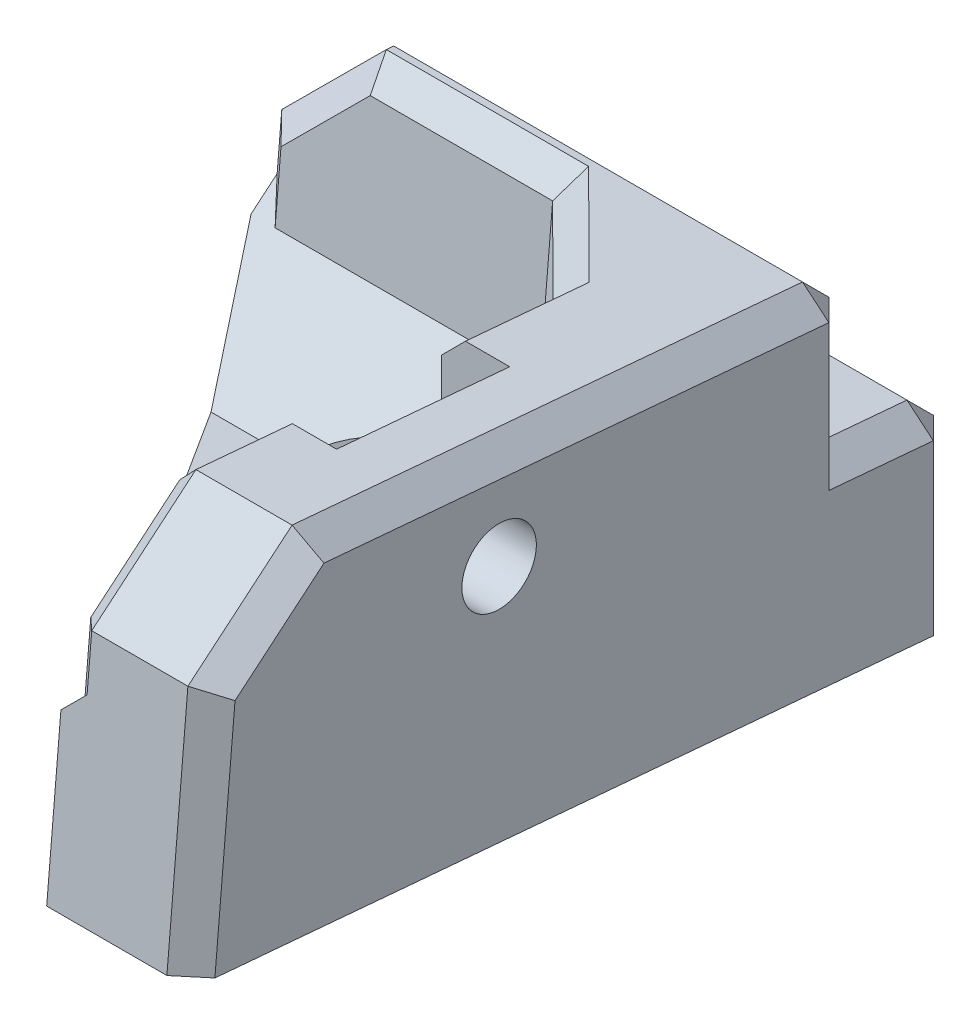
from build123d import *
from OCP.BRepFilletAPI import BRepFilletAPI_MakeChamfer

# Parameters (mm, degrees)
BOSS_EXTRUDE3_DEPTH             = 12.7
CUT_EXTRUDE1_DEPTH              = 2446.156245266122
CUT_EXTRUDE2_DEPTH              = 25.4
BOSS_EXTRUDE4_DEPTH             = 9.525
BOSS_EXTRUDE5_START             = -133.985000001
BOSS_EXTRUDE5_DEPTH             = 34.925
CUT_EXTRUDE3_REACH              = 2445.46
SKETCH12_W                      = 34.925000000000026
SKETCH12_H                      = 0.3325309889783057
CHAMFER4_SIZE                   = 6.35
CHAMFER5_SIZE                   = 1.5875
CHAMFER5_SIZE2                  = 1.7463498023569755
CHAMFER5_SIZE2_2                = 1.7463498023569135
CHAMFER5_SIZE2_3                = 1.695194438361193
CUT_EXTRUDE5_START              = 10.8585
CUT_EXTRUDE5_DEPTH              = 10.8585
F_8_START                       = -200.342016287
F_8_CLEARANCE_HOLE1_2_OUTLINE_W = 7
F_8_CLEARANCE_HOLE1_2_OUTLINE_H = 7
F_8_CLEARANCE_HOLE1_2_DEPTH     = 0.279842574
F_8_CLEARANCE_HOLE2_D           = 4.9149
CUT_EXTRUDE6_REACH              = 253.711
SKETCH24_R                      = 7.937499999999993


with BuildPart() as part:
    # Sketch6 → Boss-Extrude3 (new body)
    with BuildSketch(Plane(origin=(2.311843e-11, -2425.8151689885194, 212.23132709558422), x_dir=(1, 9.46e-15, -8.3e-16), z_dir=(9.493905125025943e-15, -0.9961946980917503, 0.08715574274760324))):
        Polygon((-99.0600000006817, -213.04201628669756), (-133.9850000006817, -213.04201628669756), (-133.9850000006817, -200.34201628669757), (-108.5850000006817, -162.24201628669755), (-99.0600000006817, -162.24201628669755), align=None)
    extrude(amount=-BOSS_EXTRUDE3_DEPTH)

    # Sketch7 → Cut-Extrude1 (cut, through all)
    with BuildSketch(Plane.ZY.offset(133.9850000006817)):
        Polygon((-2.4964e-13, -2444.383004154433), (0, -2431.6344922176327), (-1.1068779328950917, -2431.7313314886683), align=None)
    extrude(amount=-CUT_EXTRUDE1_DEPTH, mode=Mode.SUBTRACT)

    # Sketch8 → Cut-Extrude2 (cut)
    with BuildSketch(Plane.ZY.offset(133.9850000006817)):
        Polygon((50.219283386547545, -2435.5274069898373), (12.26426538925185, -2438.848040788521), (11.544794732870468, -2430.6244535557735), (49.49981273016616, -2427.30381975709), align=None)
    extrude(amount=-CUT_EXTRUDE2_DEPTH, mode=Mode.SUBTRACT)

    # Sketch10 → Boss-Extrude4 (add, through all)
    with BuildSketch(Plane.ZY.offset(108.58500000067501)):
        Polygon((49.499812730166134, -2427.3038197570895), (11.544794732870441, -2430.624453555773), (10.711465212786628, -2421.099453555773), (48.66648321008233, -2417.7788197570894), align=None)
    extrude(amount=-BOSS_EXTRUDE4_DEPTH)

    # Boss-Extrude5: read off the stored shape, not the designer's step
    # Boss-Extrude5 outline → Boss-Extrude5 (add)
    with BuildSketch(Plane.YZ.offset(BOSS_EXTRUDE5_START)):
        Polygon((-2420.768187948, 10.682483227), (-2430.624453556, 11.544794733), (-2431.031161645, 6.8961), (-2421.099453556, 6.8961), align=None)
    extrude(amount=BOSS_EXTRUDE5_DEPTH)

    # Sketch12 → Cut-Extrude3 (cut, up to next)
    with BuildSketch(Plane(origin=(0, -17.46095723301537, -199.5796544297948), x_dir=(1, 0, 0), z_dir=(0, 0.0871557427475931, 0.9961946980917512)), mode=Mode.PRIVATE) as cut_extrude3_sk1:
        with Locations((-116.52250000065857, -2412.653739397144)):
            Rectangle(SKETCH12_W, SKETCH12_H)
    cut_extrude3_tool1 = extrude(cut_extrude3_sk1.sketch, amount=-CUT_EXTRUDE3_REACH, mode=Mode.PRIVATE) & part.part
    add(cut_extrude3_tool1.solids().sort_by_distance((-116.5225, -2420.933821, 10.696974))[0], mode=Mode.SUBTRACT)

    # Chamfer4
    chamfer4_edges = [part.edges().sort_by_distance(p)[0] for p in [
        (-108.58500000065862, -2437.1877238891802, 31.241774387899785),
        (-108.58500000065875, -2425.8619535557737, 11.1281299728286),
        (-121.28500000065863, -2438.848040788522, 12.26426538925195),
        (-103.82250000065878, -2417.7788197570903, 48.6664832100824),
        (-133.98500000065857, -2421.266354157439, 8.803782606393371),
    ]]
    chamfer(chamfer4_edges, length=CHAMFER4_SIZE)

    # Chamfer5: one chamfer whose edges measure the first distance from different faces: ONE call of the kernel's chamfer builder (chamfer() names one face for all edges)
    chamfer5_edges_1 = [part.edges().sort_by_distance(p)[0] for p in [
        (-111.76000000038354, -2420.822734072567, 13.874383379035507),
        (-99.0600000006587, -2431.3328269313633, 3.4480500000041445),
        (-99.06000000065865, -2438.0087481860337, -4.5e-14),
        (-133.98500000065866, -2438.008748186034, -1.396e-14),
        (-133.98500000065872, -2431.332826931364, 3.448050000004116),
        (-133.985000001, -2429.419336186252, 6.8961),
        (-99.060000001, -2426.232208202052, 6.8961),
        (-108.58500000065878, -2419.43913665644, 29.688974211344913),
        (-99.06000000075693, -2419.8827567413205, 24.618373438599672),
        (-121.28500000051437, -2421.099453555774, 10.711465212786711),
        (-133.985000001, -2429.024871722332, 11.404849456074741),
        (-130.81000000070145, -2424.262371722282, 10.988184695738429),
        (-99.06000000065865, -2432.030074256415, 49.91330641979526),
        (-108.5850000006587, -2426.6531133734643, 49.44288329831503),
        (-108.58500000065877, -2421.218457406756, 45.780284526864456),
        (-99.06000000065876, -2421.2184574067555, 45.78028452686439),
    ]]
    chamfer5_edges_2 = [part.edges().sort_by_distance(p)[0] for p in [
        (-116.52250000065871, -2431.634492217634, 9.642e-14),
    ]]
    chamfer5_side_2 = [part.faces().sort_by_distance(p)[0] for p in [
        (-116.52250000065865, -2438.008748186034, -2.841e-14),
    ]]
    chamfer5_edges_3 = [part.edges().sort_by_distance(p)[0] for p in [
        (-113.34750000082943, -2421.433254759104, 6.896099999999999),
    ]]
    chamfer5_side_3 = [part.faces().sort_by_distance(p)[0] for p in [
        (-115.53645576803177, -2426.404038617734, 6.8961),
    ]]
    chamfer5_edges_4 = [part.edges().sort_by_distance(p)[0] for p in [
        (-130.81000000070134, -2424.6203827433465, 6.8961),
    ]]
    chamfer5_side_4 = [part.faces().sort_by_distance(p)[0] for p in [
        (-130.8815677895093, -2424.512945541763, 8.945261119766531),
    ]]
    chamfer5 = BRepFilletAPI_MakeChamfer(part.part.solid().wrapped)
    for e in chamfer5_edges_1:
        chamfer5.Add(CHAMFER5_SIZE, e.wrapped)
    for e in chamfer5_edges_2:
        chamfer5.Add(CHAMFER5_SIZE, CHAMFER5_SIZE2, e.wrapped, chamfer5_side_2[0].wrapped)  # the first distance lies on this face
    for e in chamfer5_edges_3:
        chamfer5.Add(CHAMFER5_SIZE, CHAMFER5_SIZE2_2, e.wrapped, chamfer5_side_3[0].wrapped)  # the first distance lies on this face
    for e in chamfer5_edges_4:
        chamfer5.Add(CHAMFER5_SIZE, CHAMFER5_SIZE2_3, e.wrapped, chamfer5_side_4[0].wrapped)  # the first distance lies on this face
    add(Compound.cast(chamfer5.Shape()), mode=Mode.REPLACE)

    # Sketch14 → CBORE for #8 Pan Head Machine Screw1 (revolve, cut)
    with BuildSketch(Plane(origin=(-108.58500000065874, -2425.9412416479745, 30.25783468724938), x_dir=(5.9e-16, 0, 1), z_dir=(-6.7e-15, 1, 0))):
        Polygon((0, 0), (-2.33e-15, 9.525000000000226), (2.4574499999999975, 9.525000000000226), (2.4574499999999997, 4.508499999999999), (5.715, 4.508499999999999), (5.715, 0), align=None)
    revolve(axis=Axis((-114.93500000065873, -2425.9412416479745, 30.257834687249385), (1, 7.96e-15, -5.9e-16)), mode=Mode.SUBTRACT)

    # Sketch16 → Cut-Extrude5 (cut)
    with BuildSketch(Plane.ZY.offset(104.07650000065875).offset(CUT_EXTRUDE5_START)):
        with BuildLine():
            Line((35.972834687249275, -2425.9412416479745), (35.972834687249254, -2417.8454644621274))
            Line((35.972834687249254, -2417.8454644621274), (24.542834687249364, -2418.845459886228))
            Line((24.542834687249364, -2418.845459886228), (24.542834687249364, -2425.9412416479745))
            ThreePointArc((24.542834687249364, -2425.9412416479745), (30.257834687249318, -2431.6562416479746), (35.972834687249275, -2425.9412416479745))
        make_face()
    extrude(amount=-CUT_EXTRUDE5_DEPTH, mode=Mode.SUBTRACT)

    # Sketch18 → Hole1 (revolve, cut)
    with BuildSketch(Plane(origin=(-121.28500000067221, -2436.8657251652107, -4.765035e-11), x_dir=(0, 1, 1.96e-14), z_dir=(1, 0, -8.3e-16))):
        Polygon((0, 0), (0, 4.6989999999999945), (2.870200000000013, 4.6989999999999945), (2.9972000000000123, 0), align=None)
    revolve(axis=Axis((-121.28500000067213, -2436.865725165213, 109.99999999995235), (-8.3e-16, 1.895e-14, -1)), mode=Mode.SUBTRACT)

    # #8 Clearance Hole1: read off the stored shape, not the designer's step
    # #8 Clearance Hole1 outline → #8 Clearance Hole1 (revolve, cut)
    with BuildSketch(Plane(origin=(-121.285000001, -2436.865725165, 0), x_dir=(1, 0, 0), z_dir=(0, -1, 0))):
        Polygon((2.45745, 4.699), (2.45745, 11.711826423), (1.590785336, 12.232571089), (0, 12.232571089), (0, 4.699), align=None)
    revolve(axis=Axis((-121.285000001, -2436.865725165, 0), (0, 0, 1)), mode=Mode.SUBTRACT)

    # 8 Clearance Hole1 2 outline → 8 Clearance Hole1 2 (add)
    with BuildSketch(Plane(origin=(0, 0, 0), x_dir=(1, 0, 0), z_dir=(0, 0.08715574274759312, 0.9961946980917512)).offset(F_8_START)):
        with Locations((-121.50000000000001, -2428.5)):
            Rectangle(F_8_CLEARANCE_HOLE1_2_OUTLINE_W, F_8_CLEARANCE_HOLE1_2_OUTLINE_H)
    extrude(amount=F_8_CLEARANCE_HOLE1_2_DEPTH)

    # #8 Clearance Hole2 (through all)
    with Locations(Plane(origin=(3.101414e-11, -2425.8151689885194, 212.23132709558124), x_dir=(-1, -1.269e-14, 1.11e-15), z_dir=(1.2736388665441791e-14, -0.9961946980917505, 0.08715574274760202))):
        with Locations((118.639166667, 188.435766287)):
            Hole(F_8_CLEARANCE_HOLE2_D / 2)

    # Sketch24 → Cut-Extrude6 (cut, up to next)
    with BuildSketch(Plane(origin=(2.307623e-11, -2421.3870835555053, 211.84391981904722), x_dir=(1, 9.46e-15, -8.3e-16), z_dir=(-9.493905125025941e-15, 0.9961946980917512, -0.08715574274759331)), mode=Mode.PRIVATE) as cut_extrude6_sk1:
        with Locations((-118.6391666673483, 188.43576628667344)):
            Circle(SKETCH24_R)
    cut_extrude6_tool1 = extrude(cut_extrude6_sk1.sketch, amount=CUT_EXTRUDE6_REACH, mode=Mode.PRIVATE) & part.part
    add(cut_extrude6_tool1.solids().sort_by_distance((-118.639167, -2437.810343, 24.125209))[0], mode=Mode.SUBTRACT)


solid = part.part
